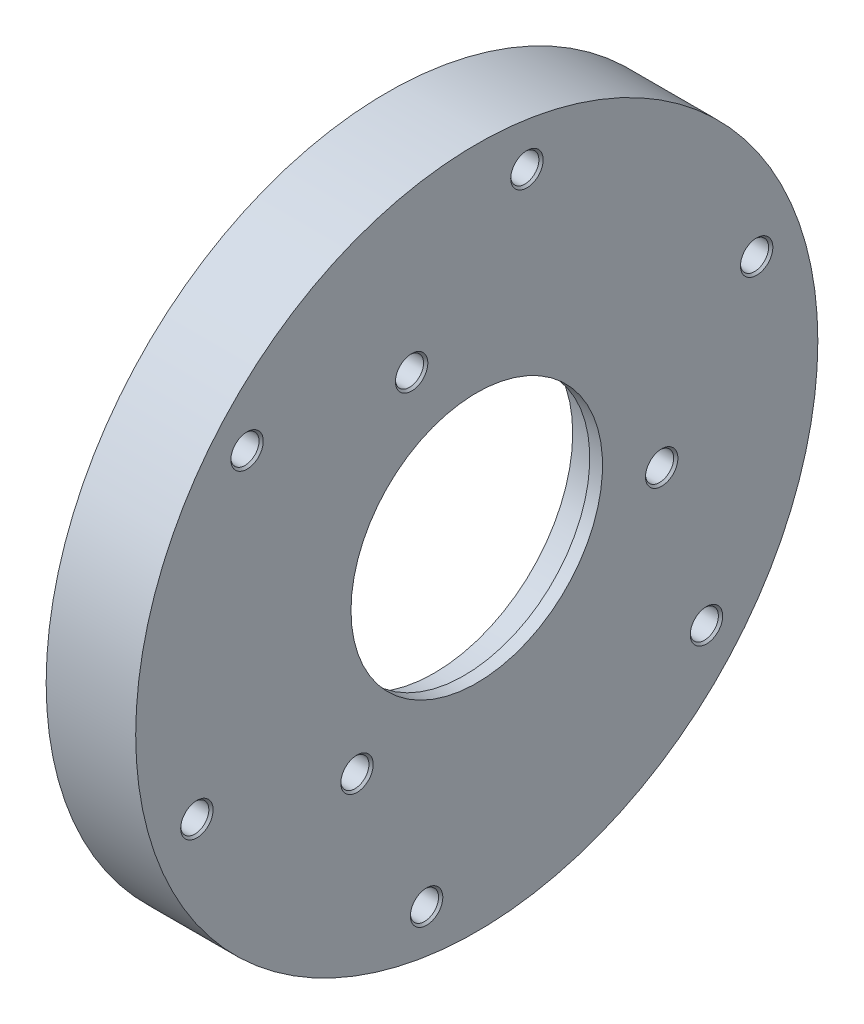
from build123d import *

# Parameters (mm, degrees)
SKETCH3_R          = 2.5
CUT_EXTRUDE1_DEPTH = 4
SKETCH6_R          = 3
CUT_EXTRUDE4_DEPTH = 11
SKETCH7_R          = 3.3
CUT_EXTRUDE5_DEPTH = 10
SKETCH9_R          = 1
CUT_EXTRUDE7_DEPTH = 2
CUT_EXTRUDE8_REACH = 117.07
SKETCH10_R         = 3.3
CHAMFER1_SIZE      = 0.5


with BuildPart() as part:
    # Sketch2 → Revolve1 (revolve)
    with BuildSketch(Plane.XY):
        Polygon((0, 80), (0, 52.5), (11, 52.5), (11, 32.5), (18, 32.5), (18, 29.5), (21, 29.5), (21, 80), align=None)
    revolve(axis=Axis((0, 0, 0), (1, 0, 0)))

    # Sketch3 → Cut-Extrude1 (cut)
    with BuildSketch(Plane.ZY):
        with Locations((0, 60)):
            Circle(SKETCH3_R)
        with Locations((12.077911205, 58.771796475)):
            Circle(SKETCH3_R)
        with Locations((23.661351307, 55.137468697)):
            Circle(SKETCH3_R)
        with Locations((34.276092906, 49.245806472)):
            Circle(SKETCH3_R)
        with Locations((43.487567234, 41.338015145)):
            Circle(SKETCH3_R)
        with Locations((50.91865545, 31.73784062)):
            Circle(SKETCH3_R)
        with Locations((56.265127929, 20.838315171)):
            Circle(SKETCH3_R)
        with Locations((59.30809946, 9.08566665)):
            Circle(SKETCH3_R)
        with Locations((59.92299043, -3.03895013)):
            Circle(SKETCH3_R)
        with Locations((58.084627132, -15.039151936)):
            Circle(SKETCH3_R)
        with Locations((53.868272374, -26.423649093)):
            Circle(SKETCH3_R)
        with Locations((47.446544216, -36.726358953)):
            Circle(SKETCH3_R)
        with Locations((39.082348963, -45.525487362)):
            Circle(SKETCH3_R)
        with Locations((29.118117752, -52.460796969)):
            Circle(SKETCH3_R)
        with Locations((17.961787378, -57.248355384)):
            Circle(SKETCH3_R)
        with Locations((6.070099319, -59.692159404)):
            Circle(SKETCH3_R)
        with Locations((-6.070099319, -59.692159404)):
            Circle(SKETCH3_R)
        with Locations((-17.961787378, -57.248355384)):
            Circle(SKETCH3_R)
        with Locations((-29.118117752, -52.460796969)):
            Circle(SKETCH3_R)
        with Locations((-39.082348963, -45.525487362)):
            Circle(SKETCH3_R)
        with Locations((-47.446544216, -36.726358953)):
            Circle(SKETCH3_R)
        with Locations((-53.868272374, -26.423649093)):
            Circle(SKETCH3_R)
        with Locations((-58.084627132, -15.039151936)):
            Circle(SKETCH3_R)
        with Locations((-59.92299043, -3.03895013)):
            Circle(SKETCH3_R)
        with Locations((-59.30809946, 9.08566665)):
            Circle(SKETCH3_R)
        with Locations((-56.265127929, 20.838315171)):
            Circle(SKETCH3_R)
        with Locations((-50.91865545, 31.73784062)):
            Circle(SKETCH3_R)
        with Locations((-43.487567234, 41.338015145)):
            Circle(SKETCH3_R)
        with Locations((-34.276092906, 49.245806472)):
            Circle(SKETCH3_R)
        with Locations((-23.661351307, 55.137468697)):
            Circle(SKETCH3_R)
        with Locations((-12.077911205, 58.771796475)):
            Circle(SKETCH3_R)
    extrude(amount=-CUT_EXTRUDE1_DEPTH, mode=Mode.SUBTRACT)

    # Sketch6 → Cut-Extrude4 (cut)
    with BuildSketch(Plane.ZY):
        with Locations((53.875586653, 44.692517973)):
            Circle(SKETCH6_R)
        with Locations((65.64264925, -24.311367699)):
            Circle(SKETCH6_R)
        with Locations((11.767062597, -69.003885672)):
            Circle(SKETCH6_R)
        with Locations((-53.875586653, -44.692517973)):
            Circle(SKETCH6_R)
        with Locations((-65.64264925, 24.311367699)):
            Circle(SKETCH6_R)
        with Locations((-11.767062597, 69.003885672)):
            Circle(SKETCH6_R)
    extrude(amount=-CUT_EXTRUDE4_DEPTH, mode=Mode.SUBTRACT)

    # Sketch7 → Cut-Extrude5 (cut)
    with BuildSketch(Plane.ZY.offset(-21)):
        with Locations((53.875586653, 44.692517973)):
            Circle(SKETCH7_R)
        with Locations((65.64264925, -24.311367699)):
            Circle(SKETCH7_R)
        with Locations((11.767062597, -69.003885672)):
            Circle(SKETCH7_R)
        with Locations((-53.875586653, -44.692517973)):
            Circle(SKETCH7_R)
        with Locations((-65.64264925, 24.311367699)):
            Circle(SKETCH7_R)
        with Locations((-11.767062597, 69.003885672)):
            Circle(SKETCH7_R)
    extrude(amount=CUT_EXTRUDE5_DEPTH, mode=Mode.SUBTRACT)

    # Sketch9 → Cut-Extrude7 (cut)
    with BuildSketch(Plane.ZY):
        with Locations((2.51770285, -71.46627686)):
            Circle(SKETCH9_R)
    extrude(amount=-CUT_EXTRUDE7_DEPTH, mode=Mode.SUBTRACT)

    # Sketch10 → Cut-Extrude8 (cut, up to next)
    with BuildSketch(Plane(origin=(21, 0, 0), x_dir=(0, 0, -1), z_dir=(1, 0, 0)), mode=Mode.PRIVATE) as cut_extrude8_sk1:
        with Locations((-15.281431125, 41.261093814)):
            Circle(SKETCH10_R)
    cut_extrude8_tool1 = extrude(cut_extrude8_sk1.sketch, amount=-CUT_EXTRUDE8_REACH, mode=Mode.PRIVATE) & part.part
    # Sketch10 → Cut-Extrude8 (cut, up to next)
    with BuildSketch(Plane(origin=(21, 0, 0), x_dir=(0, 0, -1), z_dir=(1, 0, 0)), mode=Mode.PRIVATE) as cut_extrude8_sk2:
        with Locations((43.373870994, -7.396439347)):
            Circle(SKETCH10_R)
    cut_extrude8_tool2 = extrude(cut_extrude8_sk2.sketch, amount=-CUT_EXTRUDE8_REACH, mode=Mode.PRIVATE) & part.part
    # Sketch10 → Cut-Extrude8 (cut, up to next)
    with BuildSketch(Plane(origin=(21, 0, 0), x_dir=(0, 0, -1), z_dir=(1, 0, 0)), mode=Mode.PRIVATE) as cut_extrude8_sk3:
        with Locations((-28.092439869, -33.864654468)):
            Circle(SKETCH10_R)
    cut_extrude8_tool3 = extrude(cut_extrude8_sk3.sketch, amount=-CUT_EXTRUDE8_REACH, mode=Mode.PRIVATE) & part.part
    add(cut_extrude8_tool1.solids().sort_by_distance((21, 41.261094, 15.281431))[0], mode=Mode.SUBTRACT)
    add(cut_extrude8_tool2.solids().sort_by_distance((21, -7.396439, -43.373871))[0], mode=Mode.SUBTRACT)
    add(cut_extrude8_tool3.solids().sort_by_distance((21, -33.864654, 28.09244))[0], mode=Mode.SUBTRACT)

    # Chamfer1
    chamfer1_edges = [part.edges().sort_by_distance(p)[0] for p in [
        (21, -69.003885672, 8.467062597),
        (21, -44.692517973, -57.175586653),
        (21, 24.311367699, -68.94264925),
        (21, 69.003885672, -15.067062597),
        (21, 44.692517973, 50.575586653),
        (21, -24.311367699, 62.34264925),
        (21, -33.864654468, 31.392439869),
        (21, -7.396439347, -40.073870994),
        (21, 41.261093814, 18.581431125),
    ]]
    chamfer(chamfer1_edges, length=CHAMFER1_SIZE)


solid = part.part
